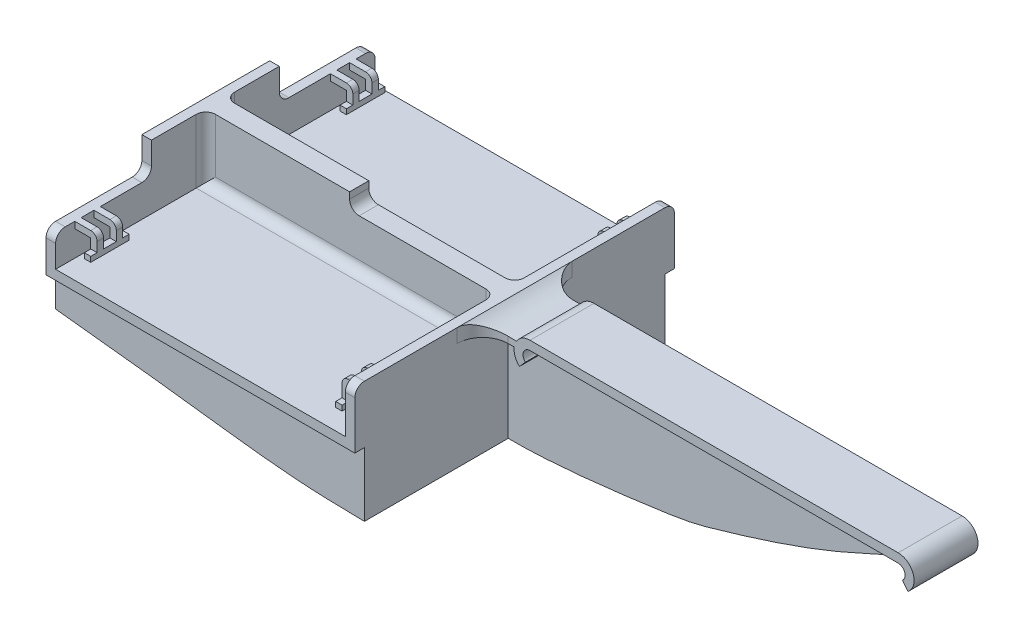
from build123d import *

# Parameters (mm, degrees)
ESTRUSIONE_ESTRUSIONE1_DEPTH       = 50
SCHIZZO2_W                         = 30
SCHIZZO2_H                         = 10
TAGLIO_ESTRUSIONE2_DEPTH           = 3
RACCORDO1_R                        = 3
ESTRUSIONE_ESTRUSIONE2_DEPTH       = 3
RACCORDO1_OF_SPECCHIA1_R           = 3
RACCORDO2_R                        = 3
SCHIZZO4_W                         = 2
SCHIZZO4_H                         = 2
ESTRUSIONE_ESTRUSIONE3_DEPTH       = 7
SCHIZZO6_W                         = 2
SCHIZZO6_H                         = 2
ESTRUSIONE_ESTRUSIONE5_DEPTH       = 3
SCHIZZO7_W                         = 2
SCHIZZO7_H                         = 12
ESTRUSIONE_ESTRUSIONE6_DEPTH       = 1.62
SCHIZZO8_W                         = 2
SCHIZZO8_H                         = 2
ESTRUSIONE_ESTRUSIONE7_DEPTH       = 7
SCHIZZO9_W                         = 2
SCHIZZO9_H                         = 2
ESTRUSIONE_ESTRUSIONE8_DEPTH       = 4
SCHIZZO10_W                        = 2
SCHIZZO10_H                        = 12
ESTRUSIONE_ESTRUSIONE9_DEPTH       = 1.62
SCHIZZO11_W                        = 96.64
SCHIZZO11_H                        = 94
ESTRUSIONE_ESTRUSIONE10_DEPTH      = 20
TAGLIO_ESTRUSIONE3_DEPTH           = 157.55813043
RACCORDO3_R                        = 2
SCHIZZO15_W                        = 4
SCHIZZO15_H                        = 38.945841007
ESTRUSIONE_ESTRUSIONE11_DEPTH      = 130
TAGLIO_ESTRUSIONE4_DEPTH           = 257.177308999
SCHIZZO18_W                        = 14.857988022
SCHIZZO18_H                        = 2.383704847
TAGLIO_ESTRUSIONE5_DEPTH           = 257.177309096
ESTRUSIONE_SOTTILE1_DEPTH          = 8
ESTRUSIONE_SOTTILE1_DEPTH_BACK     = 12
ESTRUSIONE_ESTRUSIONE13_DEPTH      = 4
ESTRUSIONE_ESTRUSIONE14_DEPTH      = 8
ESTRUSIONE_ESTRUSIONE14_DEPTH_BACK = 12
RACCORDO4_R                        = 8
RACCORDO5_R                        = 3


with BuildPart() as part:
    # Schizzo1 → Estrusione-Estrusione1 (new body)
    with BuildSketch(Plane.XY):
        Polygon((25.288328624, 10.943510702), (25.288328624, 30.943510702), (22.288328624, 30.943510702), (22.288328624, 7.943510702), (118.928328624, 7.943510702), (118.928328624, 25.943510702), (115.928328624, 25.943510702), (115.928328624, 10.943510702), align=None)
    estrusione_estrusione1 = extrude(amount=ESTRUSIONE_ESTRUSIONE1_DEPTH)

    # Schizzo2 → Taglio-Estrusione2 (cut)
    with BuildSketch(Plane(origin=(25.288328624, 0, 0), x_dir=(0, 0, -1), z_dir=(1, 0, 0))):
        with Locations((-35, 25.943510702)):
            Rectangle(SCHIZZO2_W, SCHIZZO2_H)
    taglio_estrusione2 = extrude(amount=-TAGLIO_ESTRUSIONE2_DEPTH, mode=Mode.SUBTRACT)

    # Raccordo1
    raccordo1_edges = [part.edges().sort_by_distance(p)[0] for p in [
        (23.788328624, 20.943510702, 20),
    ]]
    fillet(raccordo1_edges, radius=RACCORDO1_R)

    # Schizzo3 → Estrusione-Estrusione2 (add)
    with BuildSketch(Plane(origin=(0, 0, 0), x_dir=(-1, 0, 0), z_dir=(0, 0, -1))):
        Polygon((-25.288328624, 30.943510702), (-70.288328624, 30.943510702), (-70.288328624, 25.943510702), (-115.928328624, 25.943510702), (-115.928328624, 10.943510702), (-25.288328624, 10.943510702), align=None)
    estrusione_estrusione2 = extrude(amount=-ESTRUSIONE_ESTRUSIONE2_DEPTH)

    # Specchia1: Estrusione-Estrusione1, Taglio-Estrusione2, Estrusione-Estrusione2 across plane
    add(estrusione_estrusione1.mirror(Plane.XY))
    add(taglio_estrusione2.mirror(Plane.XY), mode=Mode.SUBTRACT)
    add(estrusione_estrusione2.mirror(Plane.XY))

    # Raccordo1 of Specchia1
    raccordo1_of_specchia1_edges = [part.edges().sort_by_distance(p)[0] for p in [
        (23.788328624, 20.943510702, -20),
    ]]
    fillet(raccordo1_of_specchia1_edges, radius=RACCORDO1_OF_SPECCHIA1_R)

    # Raccordo2
    raccordo2_edges = [part.edges().sort_by_distance(p)[0] for p in [
        (70.608328624, 10.943510702, 3),
        (70.608328624, 10.943510702, -3),
        (115.928328624, 18.443510702, -3),
        (115.928328624, 18.443510702, 3),
        (70.288328624, 25.943510702, 0),
        (25.288328624, 20.943510702, -3),
        (25.288328624, 20.943510702, 3),
    ]]
    fillet(raccordo2_edges, radius=RACCORDO2_R)

    # Schizzo4 → Estrusione-Estrusione3 (add)
    with BuildSketch(Plane(origin=(25.288328624, 0, 0), x_dir=(0, 0, -1), z_dir=(1, 0, 0))):
        with Locations((-43, 19.943510702)):
            Rectangle(SCHIZZO4_W, SCHIZZO4_H)
        with Locations((-37, 19.943510702)):
            Rectangle(SCHIZZO4_W, SCHIZZO4_H)
    estrusione_estrusione3 = extrude(amount=ESTRUSIONE_ESTRUSIONE3_DEPTH)

    # Schizzo6 → Estrusione-Estrusione5 (add)
    with BuildSketch(Plane.XZ.offset(-18.943510702)):
        with Locations((31.288328624, 43)):
            Rectangle(SCHIZZO6_W, SCHIZZO6_H)
        with Locations((31.288328624, 37)):
            Rectangle(SCHIZZO6_W, SCHIZZO6_H)
    estrusione_estrusione5 = extrude(amount=ESTRUSIONE_ESTRUSIONE5_DEPTH)

    # Schizzo7 → Estrusione-Estrusione6 (add)
    with BuildSketch(Plane.XZ.offset(-15.943510702)):
        with Locations((31.288328624, 40)):
            Rectangle(SCHIZZO7_W, SCHIZZO7_H)
    estrusione_estrusione6 = extrude(amount=ESTRUSIONE_ESTRUSIONE6_DEPTH)

    # Schizzo8 → Estrusione-Estrusione7 (add)
    with BuildSketch(Plane.ZY.offset(-115.928328624)):
        with Locations((43, 19.943510702)):
            Rectangle(SCHIZZO8_W, SCHIZZO8_H)
        with Locations((37, 19.943510702)):
            Rectangle(SCHIZZO8_W, SCHIZZO8_H)
    estrusione_estrusione7 = extrude(amount=ESTRUSIONE_ESTRUSIONE7_DEPTH)

    # Schizzo9 → Estrusione-Estrusione8 (add)
    with BuildSketch(Plane.XZ.offset(-18.943510702)):
        with Locations((109.928328624, 43)):
            Rectangle(SCHIZZO9_W, SCHIZZO9_H)
        with Locations((109.928328624, 37)):
            Rectangle(SCHIZZO9_W, SCHIZZO9_H)
    estrusione_estrusione8 = extrude(amount=ESTRUSIONE_ESTRUSIONE8_DEPTH)

    # Schizzo10 → Estrusione-Estrusione9 (add)
    with BuildSketch(Plane.XZ.offset(-14.943510702)):
        with Locations((109.928328624, 40)):
            Rectangle(SCHIZZO10_W, SCHIZZO10_H)
    estrusione_estrusione9 = extrude(amount=ESTRUSIONE_ESTRUSIONE9_DEPTH)

    # Specchia2: Estrusione-Estrusione3, Estrusione-Estrusione5, Estrusione-Estrusione6, Estrusione-Estrusione7, Estrusione-Estrusione8, Estrusione-Estrusione9 across plane
    add(estrusione_estrusione3.mirror(Plane.XY))
    add(estrusione_estrusione5.mirror(Plane.XY))
    add(estrusione_estrusione6.mirror(Plane.XY))
    add(estrusione_estrusione7.mirror(Plane.XY))
    add(estrusione_estrusione8.mirror(Plane.XY))
    add(estrusione_estrusione9.mirror(Plane.XY))

    # Schizzo11 → Estrusione-Estrusione10 (add)
    with BuildSketch(Plane.XZ.offset(-7.943510702)):
        with Locations((70.608328624, 0)):
            Rectangle(SCHIZZO11_W, SCHIZZO11_H)
    extrude(amount=ESTRUSIONE_ESTRUSIONE10_DEPTH)

    # Schizzo13 → Taglio-Estrusione3 (cut, through all)
    with BuildSketch(Plane(origin=(0, 0, -47), x_dir=(-1, 0, 0), z_dir=(0, 0, -1))):
        with BuildLine():
            Line((-118.928328624, -12.056489298), (-22.288328624, -12.056489298))
            Line((-22.288328624, -12.056489298), (-22.288328624, -2.83848693))
            add(Edge.make_bspline(
                [(-118.928328624, -12.056489298), (-113.322099804, -11.960873406), (-97.153896282, -11.703771959), (-74.904695851, -8.968869428), (-56.986118506, -6.650199928), (-40.654269451, -4.941049786), (-29.912378885, -3.687713121), (-22.288328624, -2.83848693)],
                knots=[0, 0, 0, 0, 0.16737759, 0.482024834, 0.664556886, 0.712915344, 0.965609415, 0.965609415, 0.965609415, 0.965609415], degree=3))
        make_face()
    extrude(amount=-TAGLIO_ESTRUSIONE3_DEPTH, mode=Mode.SUBTRACT)

    # Raccordo3
    raccordo3_edges = [part.edges().sort_by_distance(p)[0] for p in [
        (32.288328624, 20.943510702, -37),
        (32.288328624, 20.943510702, -43),
        (108.928328624, 20.943510702, -37),
        (108.928328624, 20.943510702, -43),
        (108.928328624, 20.943510702, 37),
        (108.928328624, 20.943510702, 43),
        (32.288328624, 20.943510702, 43),
        (32.288328624, 20.943510702, 37),
    ]]
    fillet(raccordo3_edges, radius=RACCORDO3_R)

    # Schizzo15 → Estrusione-Estrusione11 (add)
    with BuildSketch(Plane(origin=(118.928328624, 0, 0), x_dir=(0, 0, -1), z_dir=(1, 0, 0))):
        with Locations((0, 6.470590199)):
            Rectangle(SCHIZZO15_W, SCHIZZO15_H)
    extrude(amount=ESTRUSIONE_ESTRUSIONE11_DEPTH)

    # Schizzo16 → Taglio-Estrusione4 (cut, through all)
    with BuildSketch(Plane.XY.offset(2)):
        with BuildLine():
            Line((118.928328624, -12.056489298), (118.928328624, -13.002330305))
            Line((118.928328624, -13.002330305), (248.928328624, -13.002330305))
            Line((248.928328624, -13.002330305), (252.855710999, -13.002330305))
            Line((252.855710999, -13.002330305), (252.855710999, 20.261882616))
            Line((252.855710999, 20.261882616), (248.928328624, 20.261882616))
            add(Edge.make_bspline(
                [(118.928328624, -12.056489298), (129.632879684, -12.239058585), (148.946283842, -10.26643015), (174.951682884, -6.659110886), (178.191715058, -5.964494336), (202.733325948, 1.44546929), (223.443694082, 8.743857764), (238.835253319, 16.628828584), (248.928328624, 20.261882616)],
                knots=[0, 0, 0, 0, 0.253781916, 0.311897961, 0.551242391, 0.60527094, 0.82226539, 1, 1, 1, 1], degree=3))
        make_face()
    extrude(amount=-TAGLIO_ESTRUSIONE4_DEPTH, mode=Mode.SUBTRACT)

    # Schizzo18 → Taglio-Estrusione5 (cut, through all)
    with BuildSketch(Plane.XY.offset(2)):
        with Locations((126.357322635, 24.751658279)):
            Rectangle(SCHIZZO18_W, SCHIZZO18_H)
    extrude(amount=-TAGLIO_ESTRUSIONE5_DEPTH, mode=Mode.SUBTRACT)

    # Schizzo19 → Estrusione-Sottile1 (add, two sides: drawn at the far end of the back side and taken through both)
    with BuildSketch(Plane.XY.offset(2).offset(-ESTRUSIONE_SOTTILE1_DEPTH_BACK)):
        with BuildLine():
            ThreePointArc((130.449487246, 17.188688479), (129.0728401, 22.707864533), (133.751200449, 25.943510702))
            Line((133.751200449, 25.943510702), (248.928328624, 25.943510702))
            ThreePointArc((248.928328624, 25.943510702), (253.655874759, 22.571487219), (252.00686226, 17.003633718))
            Line((252.00686226, 17.003633718), (250.282883424, 19.209964829))
            ThreePointArc((250.282883424, 19.209964829), (251.008448923, 21.659820369), (248.928328624, 23.143510702))
            Line((248.928328624, 23.143510702), (133.751200449, 23.143510702))
            ThreePointArc((133.751200449, 23.143510702), (131.692721896, 21.719826388), (132.29844664, 19.291388924))
            Line((132.29844664, 19.291388924), (130.449487246, 17.188688479))
        make_face()
    extrude(amount=ESTRUSIONE_SOTTILE1_DEPTH + ESTRUSIONE_SOTTILE1_DEPTH_BACK)

    # Schizzo21 → Estrusione-Estrusione13 (add)
    with BuildSketch(Plane.XY.offset(2)):
        with BuildLine():
            Line((253.351151823, 19.209964829), (245.347993178, 19.209964829))
            ThreePointArc((245.347993178, 19.209964829), (249.3495725, 25.167356575), (253.351151823, 19.209964829))
        make_face()
    extrude(amount=-ESTRUSIONE_ESTRUSIONE13_DEPTH)

    # Schizzo22 → Estrusione-Estrusione14 (add, two sides: drawn at the far end of the back side and taken through both)
    with BuildSketch(Plane.XY.offset(2).offset(-ESTRUSIONE_ESTRUSIONE14_DEPTH_BACK)):
        with BuildLine():
            Line((118.928328624, 25.943510702), (118.928328624, 21.638281439))
            Line((118.928328624, 21.638281439), (128.958892468, 21.638281439))
            Line((128.958892468, 21.638281439), (129.490332032, 23.559805855))
            add(Edge.make_bspline(
                [(118.928328624, 25.943510702), (120.388099853, 24.873456958), (123.908605242, 23.575498905), (127.619240643, 23.564705615), (129.490332032, 23.559805855)],
                knots=[0, 0, 0, 0, 0.488492938, 1, 1, 1, 1], degree=3))
        make_face()
    extrude(amount=ESTRUSIONE_ESTRUSIONE14_DEPTH + ESTRUSIONE_ESTRUSIONE14_DEPTH_BACK)

    # Raccordo4
    raccordo4_edges = [part.edges().sort_by_distance(p)[0] for p in [
        (118.928328624, 23.79089607, -10),
        (118.928328624, 23.79089607, 10),
    ]]
    fillet(raccordo4_edges, radius=RACCORDO4_R)

    # Raccordo5
    raccordo5_edges = [part.edges().sort_by_distance(p)[0] for p in [
        (23.788328624, 20.943510702, -50),
        (117.428328624, 25.943510702, -50),
        (117.428328624, 25.943510702, 50),
        (23.788328624, 20.943510702, 50),
    ]]
    fillet(raccordo5_edges, radius=RACCORDO5_R)


solid = part.part
